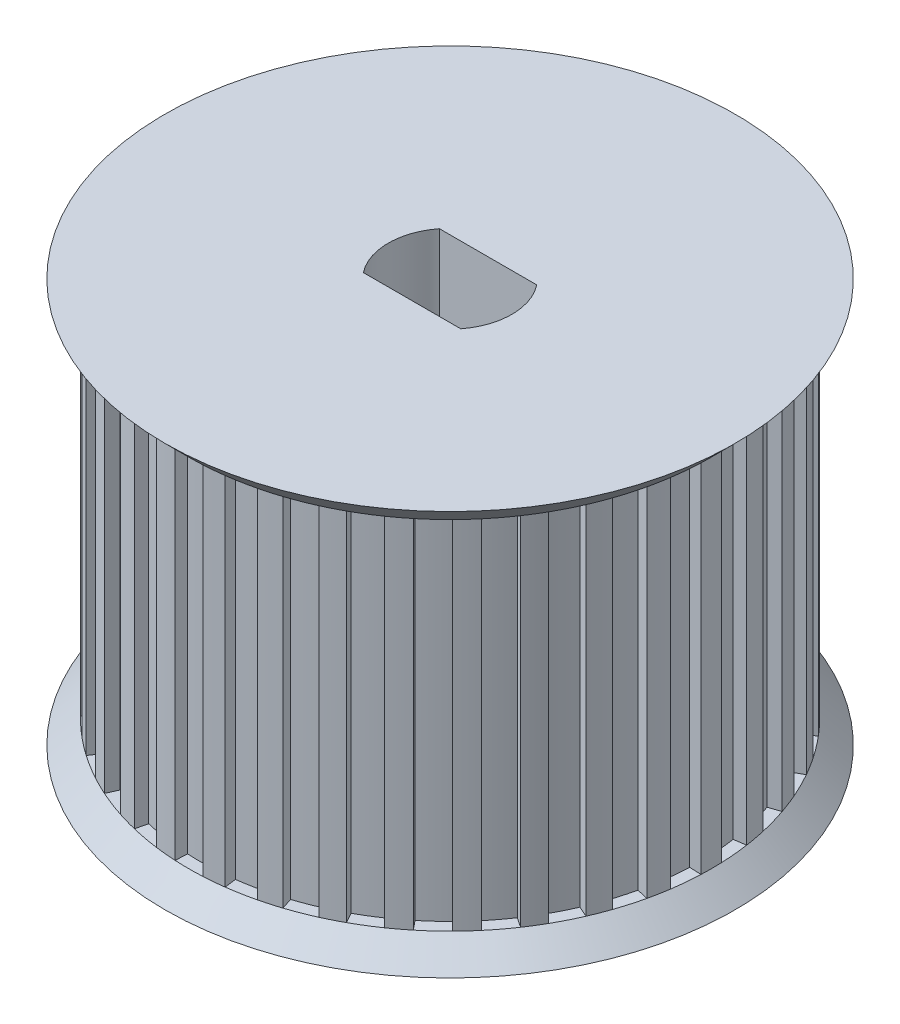
from build123d import *

# Parameters (mm, degrees)
SKETCH1_R           = 12
BOSS_EXTRUDE1_DEPTH = 1
SKETCH2_R           = 11
BOSS_EXTRUDE2_DEPTH = 15
SKETCH3_R           = 12
BOSS_EXTRUDE3_DEPTH = 1
CHAMFER1_SIZE       = 1
CUT_EXTRUDE3_REACH  = 26.021
CUT_EXTRUDE5_START  = -16
CUT_EXTRUDE5_DEPTH  = 15
CIRPATTERN3_COUNT   = 34


with BuildPart() as part:
    # Sketch1 → Boss-Extrude1 (new body)
    with BuildSketch(Plane(origin=(0, 0, 0), x_dir=(1, 0, 0), z_dir=(0, 1, 0))):
        with Locations(Location((0, 0, 0), (0, 0, 270))):
            Circle(SKETCH1_R)
    extrude(amount=BOSS_EXTRUDE1_DEPTH)

    # Sketch2 → Boss-Extrude2 (add)
    with BuildSketch(Plane(origin=(0, 1, 0), x_dir=(1, 0, 0), z_dir=(0, 1, 0))):
        with Locations(Location((0, 0, 0), (0, 0, 270))):
            Circle(SKETCH2_R)
    extrude(amount=BOSS_EXTRUDE2_DEPTH)

    # Sketch3 → Boss-Extrude3 (add)
    with BuildSketch(Plane(origin=(0, 16, 0), x_dir=(1, 0, 0), z_dir=(0, 1, 0))):
        with Locations(Location((0, 0, 0), (0, 0, 270))):
            Circle(SKETCH3_R)
    extrude(amount=BOSS_EXTRUDE3_DEPTH)

    # Chamfer1
    chamfer1_edges = [part.edges().sort_by_distance(p)[0] for p in [
        (0, 1, -12),
        (0, 16, -12),
    ]]
    chamfer(chamfer1_edges, length=CHAMFER1_SIZE - 0.0001)  # a hair under: the kernel refuses the full size

    # Sketch4 → Cut-Extrude3 (cut, up to next)
    with BuildSketch(Plane(origin=(0, 0, 0), x_dir=(1, 0, 0), z_dir=(0, 1, 0)), mode=Mode.PRIVATE) as cut_extrude3_sk1:
        with BuildLine():
            Line((-2.049390153, 1.6), (2.049390153, 1.6))
            ThreePointArc((2.049390153, 1.6), (2.6, 0), (2.049390153, -1.6))
            Line((2.049390153, -1.6), (-2.049390153, -1.6))
            ThreePointArc((-2.049390153, -1.6), (-2.6, 0), (-2.049390153, 1.6))
        make_face()
    cut_extrude3_tool1 = extrude(cut_extrude3_sk1.sketch, amount=CUT_EXTRUDE3_REACH, mode=Mode.PRIVATE) & part.part
    add(cut_extrude3_tool1.solids().sort_by_distance((0, 0, 0))[0], mode=Mode.SUBTRACT)

    # Sketch7 → Cut-Extrude5 (cut)
    with BuildSketch(Plane(origin=(0, 17, 0), x_dir=(1, 0, 0), z_dir=(0, 1, 0)).offset(CUT_EXTRUDE5_START)):
        with BuildLine():
            Line((0.586666667, 10.984344415), (0.56, 10.485056032))
            ThreePointArc((0.56, 10.485056032), (0, 10.5), (-0.56, 10.485056032))
            Line((-0.56, 10.485056032), (-0.586666667, 10.984344415))
            ThreePointArc((-0.586666667, 10.984344415), (0, 11), (0.586666667, 10.984344415))
        make_face()
    cut_extrude5 = extrude(amount=CUT_EXTRUDE5_DEPTH, mode=Mode.SUBTRACT)

    # CirPattern3: Cut-Extrude5 ×34 about axis
    cirpattern3_axis = Axis((0, 0, 0), (0, 1, 0))
    for i in range(1, CIRPATTERN3_COUNT):
        add(cut_extrude5.rotate(cirpattern3_axis, i * 360 / CIRPATTERN3_COUNT), mode=Mode.SUBTRACT)


solid = part.part
